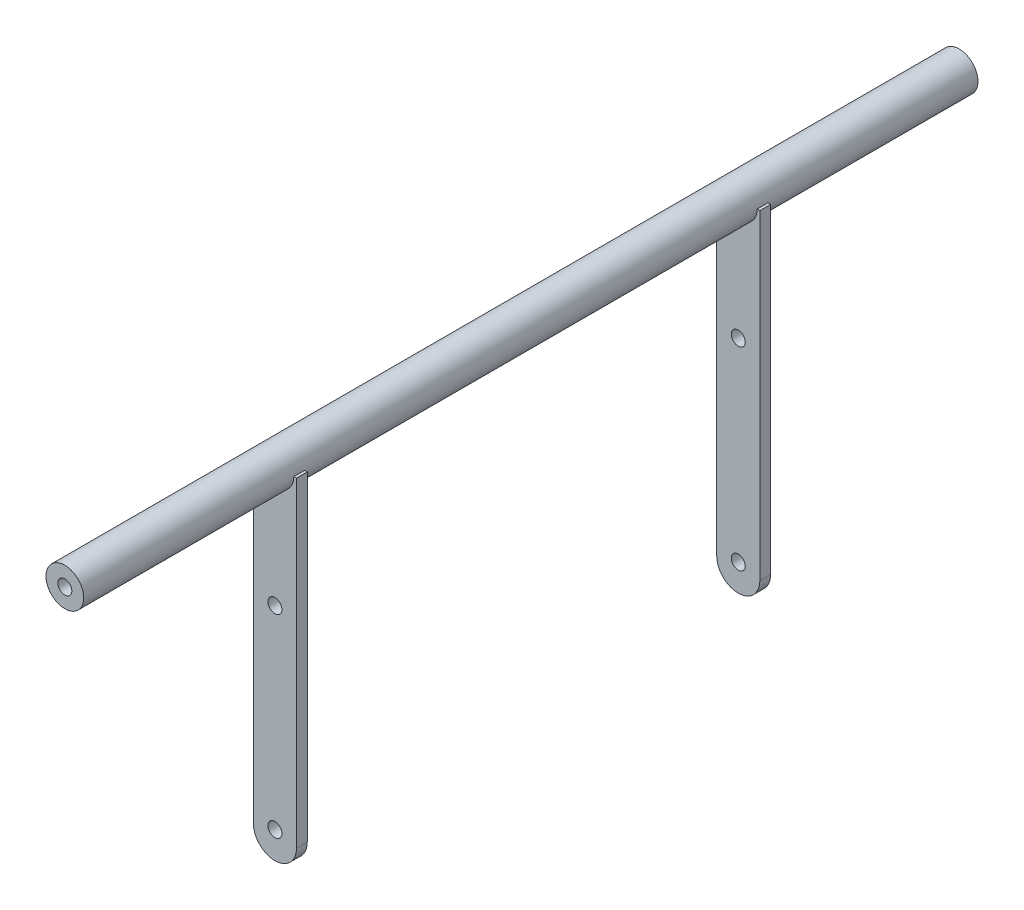
from build123d import *

# Parameters (mm, degrees)
SKETCH1_R           = 17.5
BOSS_EXTRUDE1_DEPTH = 415
CUT_EXTRUDE1_REACH  = 832.369
SKETCH2_R           = 6.5
SKETCH3_W           = 10
SKETCH3_H           = 317.5
BOSS_EXTRUDE2_DEPTH = 20
FILLET1_R           = 20
SKETCH4_R           = 6.5
CUT_EXTRUDE2_DEPTH  = 542


with BuildPart() as part:
    # Sketch1 → Boss-Extrude1 (new, symmetric)
    with BuildSketch(Plane.XY):
        Circle(SKETCH1_R)
    extrude(amount=BOSS_EXTRUDE1_DEPTH, both=True)

    # Sketch2 → Cut-Extrude1 (cut, up to next)
    with BuildSketch(Plane.XY.offset(415), mode=Mode.PRIVATE) as cut_extrude1_sk1:
        Circle(SKETCH2_R)
    cut_extrude1_tool1 = extrude(cut_extrude1_sk1.sketch, amount=-CUT_EXTRUDE1_REACH, mode=Mode.PRIVATE) & part.part
    add(cut_extrude1_tool1.solids().sort_by_distance((0, 0, 415))[0], mode=Mode.SUBTRACT)

    # Sketch3 → Boss-Extrude2 (add, symmetric)
    with BuildSketch(Plane(origin=(0, 0, 0), x_dir=(0, 0, -1), z_dir=(1, 0, 0))):
        with Locations((-215, -158.75)):
            Rectangle(SKETCH3_W, SKETCH3_H)
        with Locations((215, -158.75)):
            Rectangle(SKETCH3_W, SKETCH3_H)
    extrude(amount=BOSS_EXTRUDE2_DEPTH, both=True)

    # Fillet1
    fillet1_edges = [part.edges().sort_by_distance(p)[0] for p in [
        (-20, -317.5, -215),
        (20, -317.5, -215),
        (-20, -317.5, 215),
        (20, -317.5, 215),
    ]]
    fillet(fillet1_edges, radius=FILLET1_R - 0.0001)  # a hair under: the kernel refuses the full size

    # Sketch4 → Cut-Extrude2 (cut)
    with BuildSketch(Plane.XY.offset(220)):
        with Locations(Location((0, -292.5, 0), (0, 0, 270))):
            Circle(SKETCH4_R)
        with Locations(Location((0, -112.5, 0), (0, 0, 270))):
            Circle(SKETCH4_R)
    extrude(amount=-CUT_EXTRUDE2_DEPTH, mode=Mode.SUBTRACT)


solid = part.part
